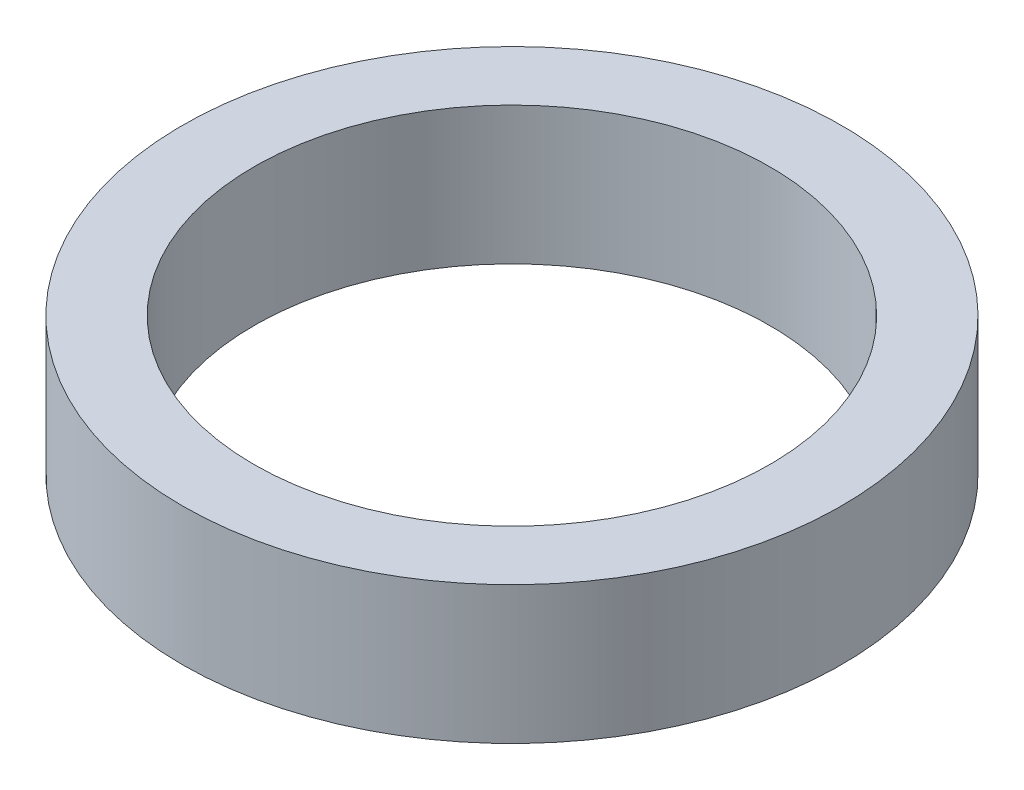
from build123d import *

# Parameters (mm, degrees)
SKETCH1_R           = 57.5
BOSS_EXTRUDE1_DEPTH = 24
SKETCH2_R           = 45
CUT_EXTRUDE1_DEPTH  = 85.785022262


with BuildPart() as part:
    # Sketch1 → Boss-Extrude1 (new body)
    with BuildSketch(Plane(origin=(0, 0, 0), x_dir=(1, 0, 0), z_dir=(0, 1, 0))):
        Circle(SKETCH1_R)
    extrude(amount=BOSS_EXTRUDE1_DEPTH)

    # Sketch2 → Cut-Extrude1 (cut, through all)
    with BuildSketch(Plane(origin=(0, 0, 0), x_dir=(1, 0, 0), z_dir=(0, 1, 0))):
        Circle(SKETCH2_R)
    extrude(amount=CUT_EXTRUDE1_DEPTH, mode=Mode.SUBTRACT)


solid = part.part
